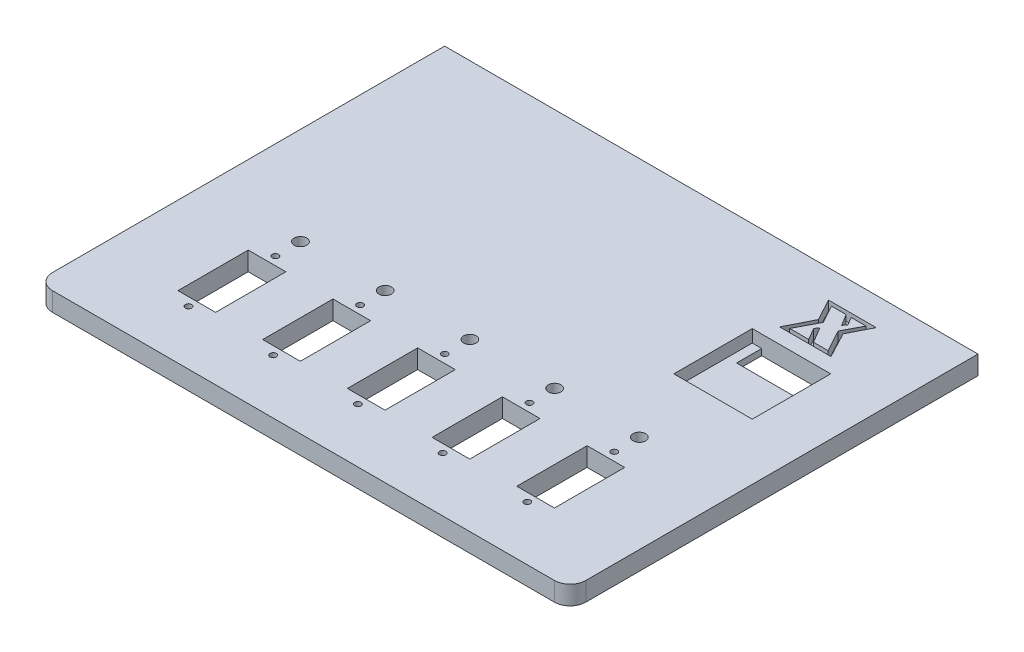
from build123d import *

# Parameters (mm, degrees)
SKETCH1_W               = 170
SKETCH1_H               = 130
BOSS_EXTRUDE1_DEPTH     = 6
SKETCH2_R               = 1
SKETCH2_R_2             = 2
SKETCH2_W               = 12
SKETCH2_H               = 22.4
CUT_EXTRUDE1_DEPTH      = 10
LPATTERN1_COUNT         = 5
LPATTERN1_PITCH         = 27
SKETCH8_W               = 25
SKETCH8_H               = 25
CUT_EXTRUDE5_DEPTH      = 108.172757733
FILLET2_R               = 5
SKETCH10_R              = 9
CUT_EXTRUDE6_DEPTH      = 2.6
MIRROR2_COPY_1_SKETCH_R = 9
MIRROR2_COPY_1_DEPTH    = 2.6
MIRROR2_COPY_2_SKETCH_R = 9
MIRROR2_COPY_2_DEPTH    = 2.6
CUT_EXTRUDE7_DEPTH      = 3
SKETCH13_W              = 25
SKETCH13_H              = 2
BOSS_EXTRUDE2_DEPTH     = 17
SKETCH14_W              = 3
SKETCH14_H              = 2
BOSS_EXTRUDE3_DEPTH     = 10


with BuildPart() as part:
    # Sketch1 → Boss-Extrude1 (new body)
    with BuildSketch(Plane(origin=(0, 0, 0), x_dir=(1, 0, 0), z_dir=(0, 1, 0))):
        Rectangle(SKETCH1_W, SKETCH1_H)
    extrude(amount=BOSS_EXTRUDE1_DEPTH)

    # Sketch2 → Cut-Extrude1 (cut)
    with BuildSketch(Plane(origin=(0, 6, 0), x_dir=(1, 0, 0), z_dir=(0, 1, 0))):
        with Locations((-54, -19.95)):
            Circle(SKETCH2_R)
        with Locations((-54, -47.65)):
            Circle(SKETCH2_R)
        with Locations((-54, -11.95)):
            Circle(SKETCH2_R_2)
        with Locations((-54, -33.8)):
            Rectangle(SKETCH2_W, SKETCH2_H)
    cut_extrude1 = extrude(amount=-CUT_EXTRUDE1_DEPTH, mode=Mode.SUBTRACT)

    # LPattern1: Cut-Extrude1 ×5
    with Locations(*[(i * LPATTERN1_PITCH, 0, 0) for i in range(1, LPATTERN1_COUNT)]):
        add(cut_extrude1, mode=Mode.SUBTRACT)

    # Sketch8 → Cut-Extrude5 (cut, through all)
    with BuildSketch(Plane(origin=(0, 6, 0), x_dir=(1, 0, 0), z_dir=(0, 1, 0))):
        with Locations((54.5, 23.55)):
            Rectangle(SKETCH8_W, SKETCH8_H)
    extrude(amount=-CUT_EXTRUDE5_DEPTH, mode=Mode.SUBTRACT)

    # Fillet2
    fillet2_edges = [part.edges().sort_by_distance(p)[0] for p in [
        (-85, 3, 65),
        (85, 3, 65),
    ]]
    fillet(fillet2_edges, radius=FILLET2_R)

    # Sketch10 → Cut-Extrude6 (cut)
    with BuildSketch(Plane.XZ):
        with Locations((-73, 53)):
            Circle(SKETCH10_R)
    cut_extrude6 = extrude(amount=-CUT_EXTRUDE6_DEPTH, mode=Mode.SUBTRACT)

    # Mirror1: Cut-Extrude6 across plane
    add(cut_extrude6.mirror(Plane(origin=(0, 0, 0), x_dir=(0, 0, 1), z_dir=(1, 0, 0))), mode=Mode.SUBTRACT)

    # Mirror2 copy 1 sketch → Mirror2 copy 1 (cut)
    with BuildSketch(Plane(origin=(0, 0, 0), x_dir=(-1, 0, 0), z_dir=(0, -1, 0))):
        with Locations((-73, 53)):
            Circle(MIRROR2_COPY_1_SKETCH_R)
    extrude(amount=-MIRROR2_COPY_1_DEPTH, mode=Mode.SUBTRACT)

    # Mirror2 copy 2 sketch → Mirror2 copy 2 (cut)
    with BuildSketch(Plane.XZ):
        with Locations((-73, -53)):
            Circle(MIRROR2_COPY_2_SKETCH_R)
    extrude(amount=-MIRROR2_COPY_2_DEPTH, mode=Mode.SUBTRACT)

    # Sketch11 → Cut-Extrude7 (cut)
    with BuildSketch(Plane(origin=(0, 6, 0), x_dir=(1, 0, 0), z_dir=(0, 1, 0))):
        Polygon((45.897368421, 40.869502872), (50.042105263, 49.063376227), (46.292105263, 56.066871293), (61.489473684, 56.066871293), (57.936842105, 49.072627872), (62.278947368, 40.869502872), align=None)
        Polygon((47.932730263, 42.053713398), (53.989473684, 42.053713398), (51.765995066, 45.856139385), (52.55546875, 47.065020964), (55.525246711, 42.053713398), (60.17265625, 42.053713398), (56.357894737, 49.069543991), (59.438692434, 54.882660767), (54.686430921, 54.882660767), (56.191365132, 52.366213398), (55.380304276, 51.151164056), (53.088980263, 54.882660767), (48.404564145, 54.882660767), (51.621052632, 49.075711754), align=None, mode=Mode.SUBTRACT)
    extrude(amount=-CUT_EXTRUDE7_DEPTH, mode=Mode.SUBTRACT)

    # Sketch13 → Boss-Extrude2 (add)
    with BuildSketch(Plane(origin=(0, 0, -11.05), x_dir=(-1, 0, 0), z_dir=(0, 0, -1))):
        with Locations((-54.5, 1)):
            Rectangle(SKETCH13_W, SKETCH13_H)
    extrude(amount=BOSS_EXTRUDE2_DEPTH)

    # Sketch14 → Boss-Extrude3 (add, symmetric)
    with BuildSketch(Plane.XY.offset(-36.05)):
        with Locations((43.5, 1)):
            Rectangle(SKETCH14_W, SKETCH14_H)
        with Locations((65.5, 1)):
            Rectangle(SKETCH14_W, SKETCH14_H)
    extrude(amount=BOSS_EXTRUDE3_DEPTH, both=True)


solid = part.part
